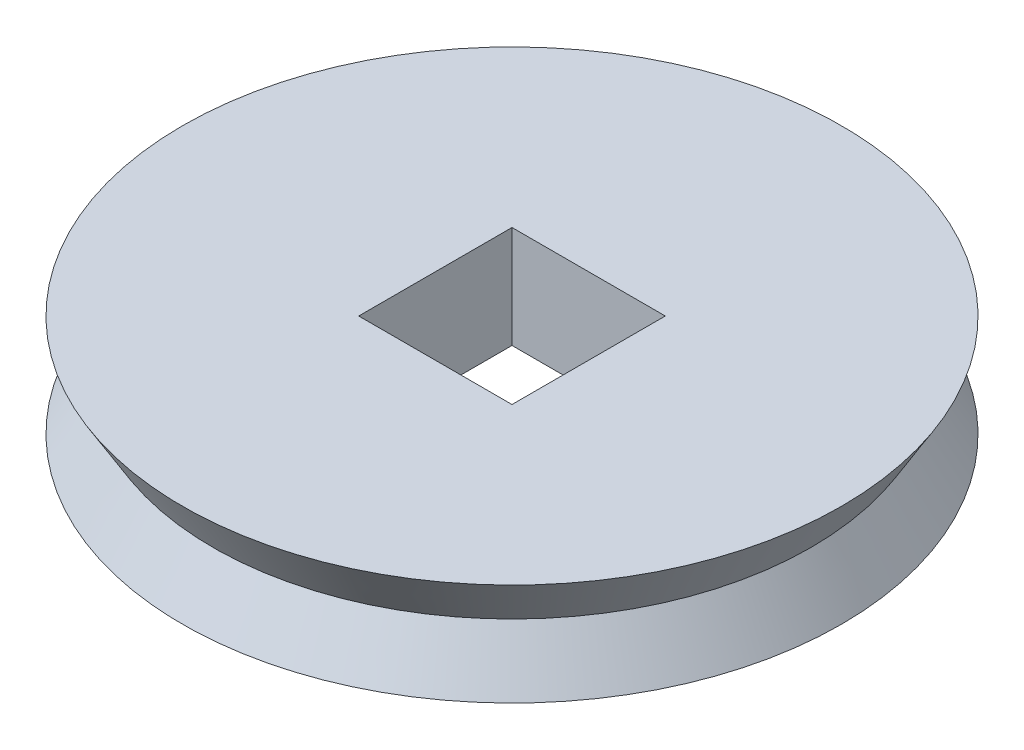
from build123d import *

# Parameters (mm, degrees)
SKETCH1_R           = 32.25
BOSS_EXTRUDE1_DEPTH = 10
SKETCH3_W           = 15
SKETCH3_H           = 15
CUT_EXTRUDE1_DEPTH  = 47.691808703


with BuildPart() as part:
    # Sketch1 → Boss-Extrude1 (new body)
    with BuildSketch(Plane(origin=(0, 0, 0), x_dir=(1, 0, 0), z_dir=(0, 1, 0))):
        Circle(SKETCH1_R)
    extrude(amount=BOSS_EXTRUDE1_DEPTH)

    # Cut-Sweep1: sweep along a path in Sketch1<2>
    with BuildLine(Plane(origin=(0, 0, 0), x_dir=(1, 0, 0), z_dir=(0, 1, 0))) as cut_sweep1_path:
        CenterArc((0, 0), 32.25, 0, 360)
    # Sketch2 → Cut-Sweep1 (sweep, cut)
    with BuildSketch(Plane.XY):
        Polygon((32.25, 10), (29.25, 5), (32.25, 0), align=None)
    sweep(path=cut_sweep1_path.line, mode=Mode.SUBTRACT)

    # Sketch3 → Cut-Extrude1 (cut, through all)
    with BuildSketch(Plane(origin=(0, 10, 0), x_dir=(1, 0, 0), z_dir=(0, 1, 0))):
        Rectangle(SKETCH3_W, SKETCH3_H)
    extrude(amount=-CUT_EXTRUDE1_DEPTH, mode=Mode.SUBTRACT)


solid = part.part
